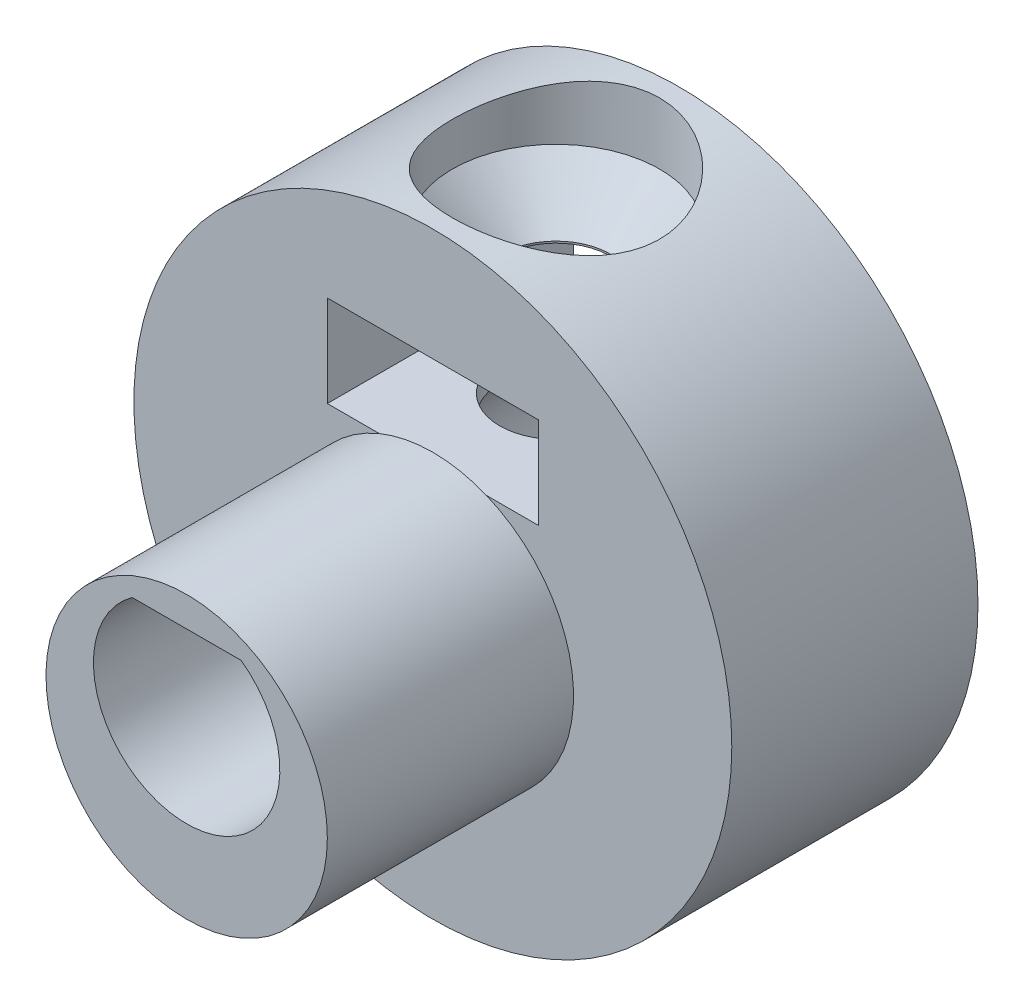
from build123d import *

# Parameters (mm, degrees)
ESQUISSE1_R             = 8.5
BOSS_EXTRU_1_DEPTH      = 7
ESQUISSE2_W             = 6
ESQUISSE2_H             = 2.6
ENL_V_MAT_EXTRU_1_DEPTH = 14.910427743
ESQUISSE7_R             = 2.95
ENL_V_MAT_EXTRU_8_DEPTH = 21.087060672
ESQUISSE9_R             = 4
BOSS_EXTRU_2_DEPTH      = 7
ENL_V_MAT_EXTRU_9_DEPTH = 19.45264218


with BuildPart() as part:
    # Esquisse1 → Boss.-Extru.1 (new body)
    with BuildSketch(Plane.XY):
        Circle(ESQUISSE1_R)
    extrude(amount=BOSS_EXTRU_1_DEPTH)

    # Esquisse2 → Enlèv. mat.-Extru.1 (cut, through all)
    with BuildSketch(Plane(origin=(0, 0, 0), x_dir=(-1, 0, 0), z_dir=(0, 0, -1))):
        with Locations((0, 4)):
            Rectangle(ESQUISSE2_W, ESQUISSE2_H)
    extrude(amount=-ENL_V_MAT_EXTRU_1_DEPTH, mode=Mode.SUBTRACT)

    # Enlèv. mat.-Extru.2: read off the stored shape, not the designer's step
    # Enlèv. mat.-Extru.2 outline → Enlèv. mat.-Extru.2 (revolve, cut)
    with BuildSketch(Plane.XY.offset(3.5)):
        Polygon((0, 5.3), (1.554616831, 5.3), (1.498760014, 8.500034923), (0, 8.500034923), align=None)
        Polygon((1.6, 2.7), (0, 2.7), (0, 0.7), (1.56508987, 0.7), align=None)
    revolve(axis=Axis((0, 0, 3.5), (0, 1, 0)), mode=Mode.SUBTRACT)

    # Esquisse7 → Enlèv. mat.-Extru.8 (cut, through all)
    with BuildSketch(Plane(origin=(0, 8.3, 0), x_dir=(1, 0, 0), z_dir=(0, 1, 0))):
        with Locations((0, -3.5)):
            Circle(ESQUISSE7_R)
    extrude(amount=ENL_V_MAT_EXTRU_8_DEPTH, mode=Mode.SUBTRACT)

    # Chanfrein1: read off the stored shape, not the designer's step
    # Chanfrein1 outline → Chanfrein1 (revolve, cut)
    with BuildSketch(Plane.XY.offset(3.5)):
        Polygon((2.95, 6.747748364), (2.95, 8.3), (1.502251636, 8.3), (1.553718474, 5.351466838), align=None)
    revolve(axis=Axis((0, 0, 3.5), (0, 1, 0)), mode=Mode.SUBTRACT)

    # Esquisse9 → Boss.-Extru.2 (add)
    with BuildSketch(Plane.XY.offset(7)):
        with Locations(Location((0, -1, 0), (0, 0, 112.331645009))):
            Circle(ESQUISSE9_R)
    extrude(amount=BOSS_EXTRU_2_DEPTH)

    # Esquisse10 → Enlèv. mat.-Extru.9 (cut, through all)
    with BuildSketch(Plane(origin=(0, 0, 0), x_dir=(-1, 0, 0), z_dir=(0, 0, -1))):
        with BuildLine():
            Line((-1.549193338, 2.15), (1.549193338, 2.15))
            ThreePointArc((1.549193338, 2.15), (0, -2.65), (-1.549193338, 2.15))
        make_face()
    extrude(amount=-ENL_V_MAT_EXTRU_9_DEPTH, mode=Mode.SUBTRACT)


solid = part.part
